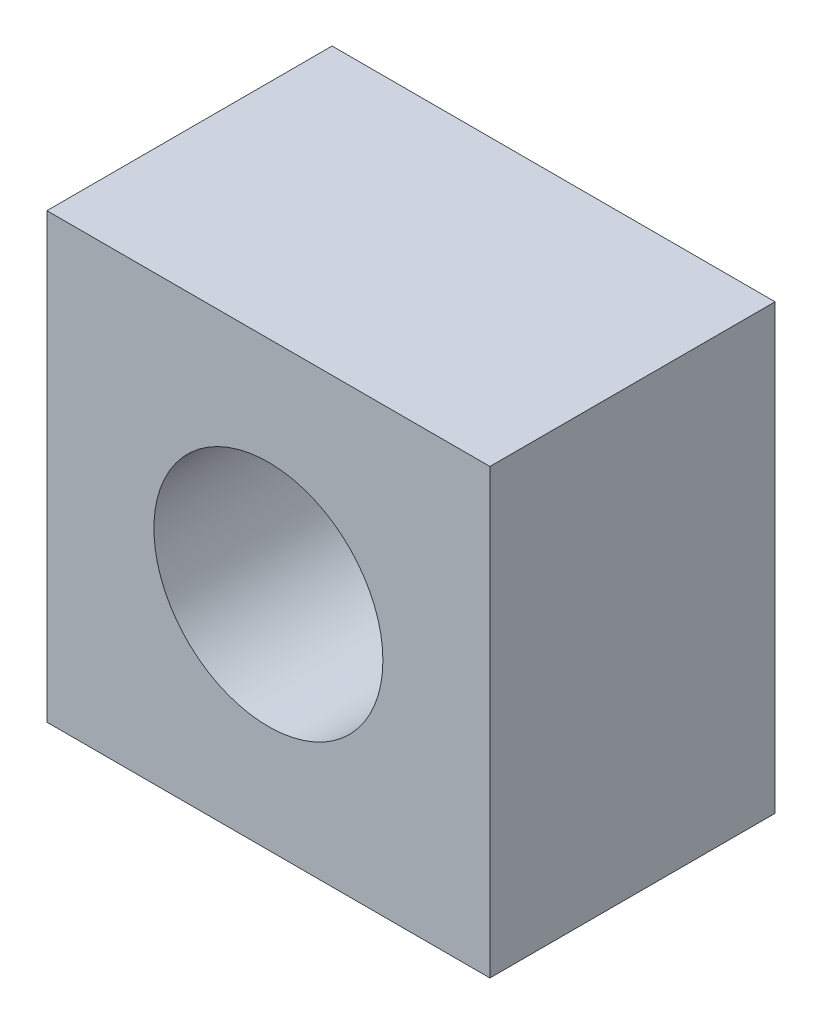
from build123d import *

# Parameters (mm, degrees)
BOSS_EXTRUDE1_DEPTH = 5.15
SKETCH2_R           = 2.0675
CUT_EXTRUDE1_DEPTH  = 13.430707944


with BuildPart() as part:
    # Sketch1 → Boss-Extrude1 (new body)
    with BuildSketch(Plane.XY):
        Polygon((0, 0), (3, 0), (7, 0), (8, 0), (8, 8), (0, 8), align=None)
    extrude(amount=BOSS_EXTRUDE1_DEPTH)

    # Sketch2 → Cut-Extrude1 (cut, through all)
    with BuildSketch(Plane.XY.offset(5.15)):
        with Locations((4, 4)):
            Circle(SKETCH2_R)
    extrude(amount=-CUT_EXTRUDE1_DEPTH, mode=Mode.SUBTRACT)


solid = part.part
